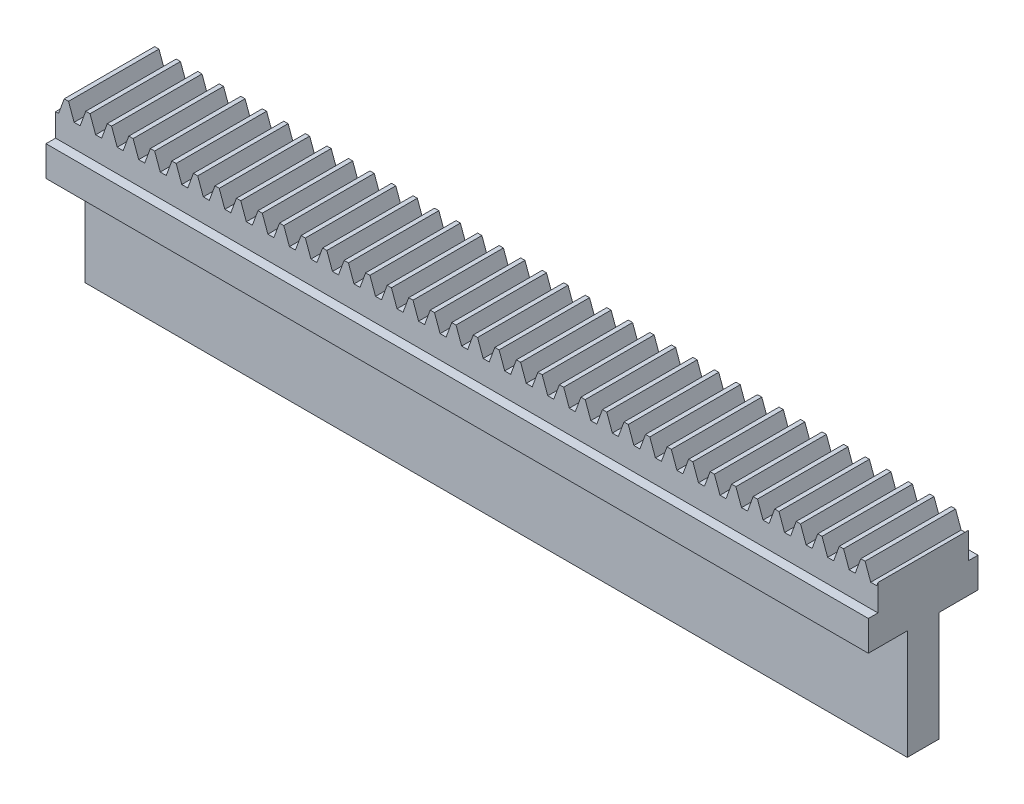
from build123d import *

# Parameters (mm, degrees)
BLANKSKE_W              = 150
BLANKSKE_H              = 12.5
BLANK_DEPTH             = 20
TOOTHCUTSIM_DEPTH       = 152.842846391
TEETHCUTS_COUNT         = 40
TEETHCUTS_PITCH         = 3.926990813
CROQUIS3_W              = 150.577281711
CROQUIS3_H              = 7.352719699
CORTAR_EXTRUIR1_DEPTH   = 1.75
CROQUIS4_W              = 150
CROQUIS4_H              = 8.901496228
CORTAR_EXTRUIR2_DEPTH   = 1.75
CROQUIS6_W              = 150
CROQUIS6_H              = 5.8
SALIENTE_EXTRUIR1_DEPTH = 20


with BuildPart() as part:
    # BlankSke → Blank (new body)
    with BuildSketch(Plane.XY):
        with Locations((75, 6.25)):
            Rectangle(BLANKSKE_W, BLANKSKE_H)
    extrude(amount=-BLANK_DEPTH)

    # TooCutSkeSim → ToothCutSim (cut, through all)
    with BuildSketch(Plane.XY):
        Polygon((0.548044212, 9.6875), (-0.548044212, 9.6875), (-1.58095534, 12.5254), (1.58095534, 12.5254), align=None)
    toothcutsim = extrude(amount=-TOOTHCUTSIM_DEPTH, mode=Mode.SUBTRACT)

    # TeethCuts: ToothCutSim ×40
    with Locations(*[(i * TEETHCUTS_PITCH, 0, 0) for i in range(1, TEETHCUTS_COUNT)]):
        add(toothcutsim, mode=Mode.SUBTRACT)

    # Croquis3 → Cortar-Extruir1 (cut)
    with BuildSketch(Plane.XY):
        with Locations((75.288640856, 9.17635985)):
            Rectangle(CROQUIS3_W, CROQUIS3_H)
    extrude(amount=-CORTAR_EXTRUIR1_DEPTH, mode=Mode.SUBTRACT)

    # Croquis4 → Cortar-Extruir2 (cut)
    with BuildSketch(Plane(origin=(0, 0, -20), x_dir=(-1, 0, 0), z_dir=(0, 0, -1))):
        with Locations((-75, 9.950748114)):
            Rectangle(CROQUIS4_W, CROQUIS4_H)
    extrude(amount=-CORTAR_EXTRUIR2_DEPTH, mode=Mode.SUBTRACT)

    # Croquis6 → Saliente-Extruir1 (add)
    with BuildSketch(Plane.XZ):
        with Locations((75, -10)):
            Rectangle(CROQUIS6_W, CROQUIS6_H)
    extrude(amount=SALIENTE_EXTRUIR1_DEPTH)


solid = part.part
